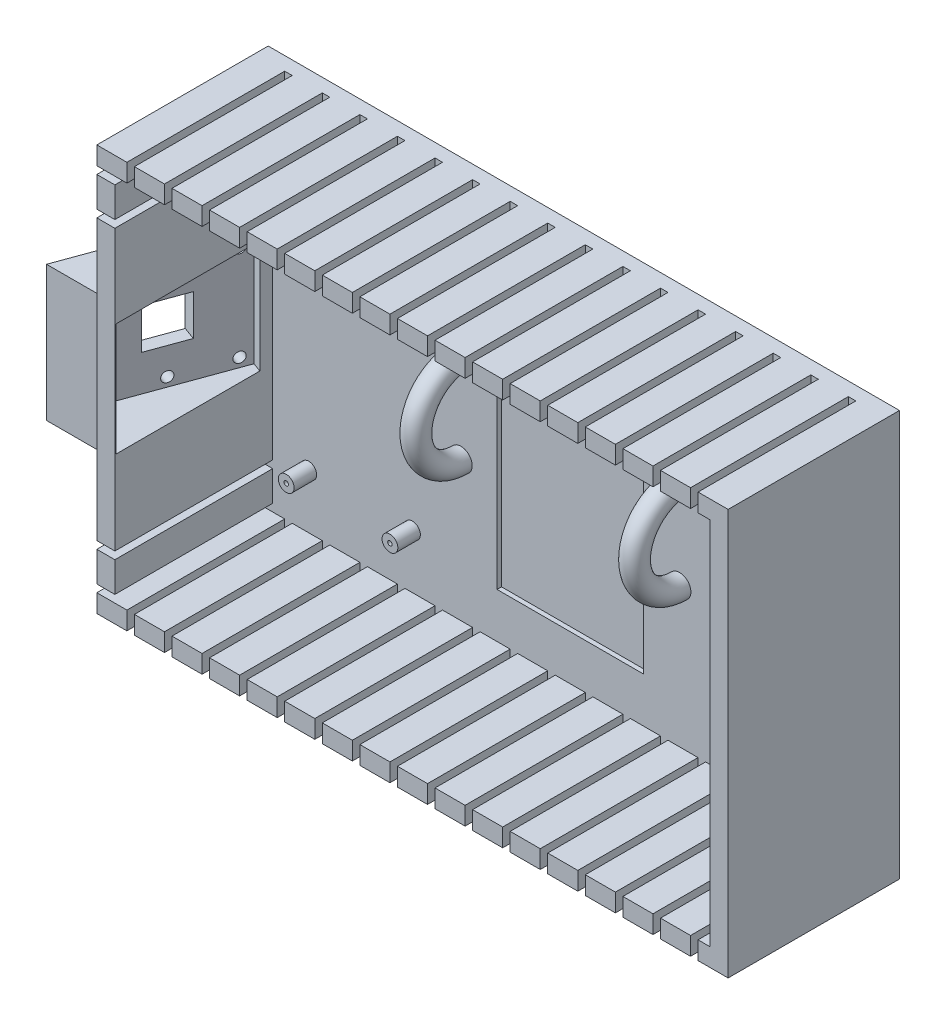
from build123d import *

# Parameters (mm, degrees)
SKETCH1_W                = 90
SKETCH1_H                = 140
BOSS_EXTRUDE1_DEPTH      = 3
SKETCH2_W                = 32.5
SKETCH2_H                = 62
CUT_EXTRUDE1_DEPTH       = 1
SKETCH6_R                = 1.75
SKETCH6_R_2              = 0.5
BOSS_EXTRUDE2_DEPTH      = 5
SKETCH6_3_R              = 0.5
BOSS_EXTRUDE3_DEPTH      = 4
SKETCH9_R                = 2.5
REVOLVE3_ANGLE           = 180
SKETCH7_W                = 6.666666667
SKETCH7_H                = 4
SKETCH7_W_2              = 6.666666666
SKETCH7_W_3              = 4
SKETCH7_H_2              = 6.666666667
SKETCH7_H_3              = 61.986666666
BOSS_EXTRUDE8_DEPTH      = 35
BOSS_EXTRUDE9_DEPTH      = 15
BOSS_EXTRUDE9_DEPTH_BACK = 15
CUT_EXTRUDE2_REACH       = 153.289
SKETCH19_W               = 9
SKETCH19_H               = 9
SKETCH19_R               = 1.15
CUT_EXTRUDE5_REACH       = 156.289
CUT_EXTRUDE5_START       = -3
SKETCH21_W               = 25
SKETCH21_H               = 30


with BuildPart() as part:
    # Sketch1 → Boss-Extrude1 (new body)
    with BuildSketch(Plane(origin=(0, 0, 0), x_dir=(0, 1, 0), z_dir=(0, 0, 1))):
        Rectangle(SKETCH1_W, SKETCH1_H)
    extrude(amount=BOSS_EXTRUDE1_DEPTH)

    # Sketch2 → Cut-Extrude1 (cut)
    with BuildSketch(Plane.XY.offset(3)):
        Rectangle(SKETCH2_W, SKETCH2_H)
    extrude(amount=-CUT_EXTRUDE1_DEPTH, mode=Mode.SUBTRACT)

    # Sketch6 → Boss-Extrude2 (add)
    # profile 1 of 4: a face of its own
    with BuildSketch(Plane.XY.offset(3)):
        with Locations((-58, 29)):
            Circle(SKETCH6_R)
        with Locations((-58, 29)):
            Circle(SKETCH6_R_2, mode=Mode.SUBTRACT)
    # profile 2 of 4: a face of its own
    with BuildSketch(Plane.XY.offset(3)):
        with Locations((-35, 29)):
            Circle(SKETCH6_R)
        with Locations((-35, 29)):
            Circle(SKETCH6_R_2, mode=Mode.SUBTRACT)
    # profile 3 of 4: a face of its own
    with BuildSketch(Plane.XY.offset(3)):
        with Locations((-35, -29)):
            Circle(SKETCH6_R)
        with Locations((-35, -29)):
            Circle(SKETCH6_R_2, mode=Mode.SUBTRACT)
    # profile 4 of 4: a face of its own
    with BuildSketch(Plane.XY.offset(3)):
        with Locations((-58, -29)):
            Circle(SKETCH6_R)
        with Locations((-58, -29)):
            Circle(SKETCH6_R_2, mode=Mode.SUBTRACT)
    extrude(amount=BOSS_EXTRUDE2_DEPTH)

    # Sketch6<3> → Boss-Extrude3 (add)
    with BuildSketch(Plane.XY.offset(3)):
        with Locations((-58, 29)):
            Circle(SKETCH6_3_R)
        with Locations((-35, 29)):
            Circle(SKETCH6_3_R)
        with Locations((-58, -29)):
            Circle(SKETCH6_3_R)
        with Locations((-35, -29)):
            Circle(SKETCH6_3_R)
    extrude(amount=BOSS_EXTRUDE3_DEPTH)

    # Sketch9 → Revolve3 (revolve)
    with BuildSketch(Plane.XY.offset(3)):
        with Locations((-24.25, -10)):
            Circle(SKETCH9_R)
        with Locations((24.25, -10)):
            Circle(SKETCH9_R)
    revolve(axis=Axis((-36.309330937, 0, 3), (-1, 0, 0)), revolution_arc=REVOLVE3_ANGLE)

    # Sketch7 → Boss-Extrude8 (add)
    with BuildSketch(Plane.XY.offset(3)):
        with Locations((-58.333333334, 43)):
            Rectangle(SKETCH7_W, SKETCH7_H)
        with Locations((-66.666666667, 43)):
            Rectangle(SKETCH7_W, SKETCH7_H)
        with Locations((-50, 43)):
            Rectangle(SKETCH7_W_2, SKETCH7_H)
        with Locations((-41.666666667, 43)):
            Rectangle(SKETCH7_W, SKETCH7_H)
        with Locations((-68, 35.996666667)):
            Rectangle(SKETCH7_W_3, SKETCH7_H_2)
        with Locations((-33.333333334, 43)):
            Rectangle(SKETCH7_W, SKETCH7_H)
        with Locations((-68, 0)):
            Rectangle(SKETCH7_W_3, SKETCH7_H_3)
        with Locations((-25, 43)):
            Rectangle(SKETCH7_W_2, SKETCH7_H)
        with Locations((-68, -35.996666667)):
            Rectangle(SKETCH7_W_3, SKETCH7_H_2)
        with Locations((-16.666666666, 43)):
            Rectangle(SKETCH7_W, SKETCH7_H)
        with Locations((-66.666666667, -43)):
            Rectangle(SKETCH7_W, SKETCH7_H)
        with Locations((-8.333333334, 43)):
            Rectangle(SKETCH7_W, SKETCH7_H)
        with Locations((-58.333333334, -43)):
            Rectangle(SKETCH7_W, SKETCH7_H)
        with Locations((0, 43)):
            Rectangle(SKETCH7_W_2, SKETCH7_H)
        with Locations((-50, -43)):
            Rectangle(SKETCH7_W_2, SKETCH7_H)
        with Locations((8.333333334, 43)):
            Rectangle(SKETCH7_W, SKETCH7_H)
        with Locations((-41.666666667, -43)):
            Rectangle(SKETCH7_W, SKETCH7_H)
        with Locations((16.666666666, 43)):
            Rectangle(SKETCH7_W, SKETCH7_H)
        with Locations((-33.333333334, -43)):
            Rectangle(SKETCH7_W, SKETCH7_H)
        with Locations((25, 43)):
            Rectangle(SKETCH7_W_2, SKETCH7_H)
        with Locations((-25, -43)):
            Rectangle(SKETCH7_W_2, SKETCH7_H)
        with Locations((33.333333334, 43)):
            Rectangle(SKETCH7_W, SKETCH7_H)
        with Locations((-16.666666666, -43)):
            Rectangle(SKETCH7_W, SKETCH7_H)
        with Locations((41.666666667, 43)):
            Rectangle(SKETCH7_W, SKETCH7_H)
        with Locations((-8.333333334, -43)):
            Rectangle(SKETCH7_W, SKETCH7_H)
        with Locations((50, 43)):
            Rectangle(SKETCH7_W_2, SKETCH7_H)
        with Locations((0, -43)):
            Rectangle(SKETCH7_W_2, SKETCH7_H)
        with Locations((58.333333334, 43)):
            Rectangle(SKETCH7_W, SKETCH7_H)
        with Locations((8.333333334, -43)):
            Rectangle(SKETCH7_W, SKETCH7_H)
        Polygon((63.333333333, 45), (63.333333333, 41), (66, 41), (66, -41), (63.333333333, -41), (63.333333333, -45), (70, -45), (70, 45), align=None)
        with Locations((16.666666666, -43)):
            Rectangle(SKETCH7_W, SKETCH7_H)
        with Locations((25, -43)):
            Rectangle(SKETCH7_W_2, SKETCH7_H)
        with Locations((33.333333334, -43)):
            Rectangle(SKETCH7_W, SKETCH7_H)
        with Locations((58.333333334, -43)):
            Rectangle(SKETCH7_W, SKETCH7_H)
        with Locations((41.666666667, -43)):
            Rectangle(SKETCH7_W, SKETCH7_H)
        with Locations((50, -43)):
            Rectangle(SKETCH7_W_2, SKETCH7_H)
    extrude(amount=BOSS_EXTRUDE8_DEPTH)

    # Sketch18 → Boss-Extrude9 (add, two sides: drawn at the far end of the back side and taken through both)
    with BuildSketch(Plane(origin=(0, 0, 0), x_dir=(-1, 0, 0), z_dir=(0, 1, 0)).offset(-BOSS_EXTRUDE9_DEPTH_BACK)):
        Polygon((70, 36.5), (82.654745303, 36.5), (70, 1.731373031), align=None)
    extrude(amount=BOSS_EXTRUDE9_DEPTH + BOSS_EXTRUDE9_DEPTH_BACK)

    # Sketch19 → Cut-Extrude2 (cut, up to next)
    with BuildSketch(Plane(origin=(-61.255102943, 0, -22.295034168), x_dir=(0, -1, 0), z_dir=(-0.9396926207859108, 0, -0.34202014332566216)), mode=Mode.PRIVATE) as cut_extrude2_sk1:
        with Locations((0, 43.068368494)):
            Rectangle(SKETCH19_W, SKETCH19_H)
    cut_extrude2_tool1 = extrude(cut_extrude2_sk1.sketch, amount=-CUT_EXTRUDE2_REACH, mode=Mode.PRIVATE) & part.part
    # Sketch19 → Cut-Extrude2 (cut, up to next)
    with BuildSketch(Plane(origin=(-61.255102943, 0, -22.295034168), x_dir=(0, -1, 0), z_dir=(-0.9396926207859108, 0, -0.34202014332566216)), mode=Mode.PRIVATE) as cut_extrude2_sk2:
        with Locations((-10.5, 43.068368494)):
            Circle(SKETCH19_R)
    cut_extrude2_tool2 = extrude(cut_extrude2_sk2.sketch, amount=-CUT_EXTRUDE2_REACH, mode=Mode.PRIVATE) & part.part
    # Sketch19 → Cut-Extrude2 (cut, up to next)
    with BuildSketch(Plane(origin=(-61.255102943, 0, -22.295034168), x_dir=(0, -1, 0), z_dir=(-0.9396926207859108, 0, -0.34202014332566216)), mode=Mode.PRIVATE) as cut_extrude2_sk3:
        with Locations((10.5, 43.068368494)):
            Circle(SKETCH19_R)
    cut_extrude2_tool3 = extrude(cut_extrude2_sk3.sketch, amount=-CUT_EXTRUDE2_REACH, mode=Mode.PRIVATE) & part.part
    # Sketch19 → Cut-Extrude2 (cut, up to next)
    with BuildSketch(Plane(origin=(-61.255102943, 0, -22.295034168), x_dir=(0, -1, 0), z_dir=(-0.9396926207859108, 0, -0.34202014332566216)), mode=Mode.PRIVATE) as cut_extrude2_sk4:
        with Locations((10.5, 30.568368494)):
            Circle(SKETCH19_R)
    cut_extrude2_tool4 = extrude(cut_extrude2_sk4.sketch, amount=-CUT_EXTRUDE2_REACH, mode=Mode.PRIVATE) & part.part
    # Sketch19 → Cut-Extrude2 (cut, up to next)
    with BuildSketch(Plane(origin=(-61.255102943, 0, -22.295034168), x_dir=(0, -1, 0), z_dir=(-0.9396926207859108, 0, -0.34202014332566216)), mode=Mode.PRIVATE) as cut_extrude2_sk5:
        with Locations((-10.5, 30.568368494)):
            Circle(SKETCH19_R)
    cut_extrude2_tool5 = extrude(cut_extrude2_sk5.sketch, amount=-CUT_EXTRUDE2_REACH, mode=Mode.PRIVATE) & part.part
    add(cut_extrude2_tool1.solids().sort_by_distance((-75.985353, 0, 18.175994))[0], mode=Mode.SUBTRACT)
    add(cut_extrude2_tool2.solids().sort_by_distance((-75.985353, 10.5, 18.175994))[0], mode=Mode.SUBTRACT)
    add(cut_extrude2_tool3.solids().sort_by_distance((-75.985353, -10.5, 18.175994))[0], mode=Mode.SUBTRACT)
    add(cut_extrude2_tool4.solids().sort_by_distance((-71.710101, -10.5, 6.429836))[0], mode=Mode.SUBTRACT)
    add(cut_extrude2_tool5.solids().sort_by_distance((-71.710101, 10.5, 6.429836))[0], mode=Mode.SUBTRACT)

    # Sketch21 → Cut-Extrude5 (cut, up to next)
    with BuildSketch(Plane(origin=(-61.255102943, 0, -22.295034168), x_dir=(0, -1, 0), z_dir=(-0.9396926207859105, 0, -0.3420201433256627)).offset(CUT_EXTRUDE5_START), mode=Mode.PRIVATE) as cut_extrude5_sk1:
        with Locations((0, 43.068368494)):
            Rectangle(SKETCH21_W, SKETCH21_H)
    cut_extrude5_tool1 = extrude(cut_extrude5_sk1.sketch, amount=-CUT_EXTRUDE5_REACH, mode=Mode.PRIVATE) & part.part
    add(cut_extrude5_tool1.solids().sort_by_distance((-73.166275, 0, 19.202054))[0], mode=Mode.SUBTRACT)


solid = part.part
